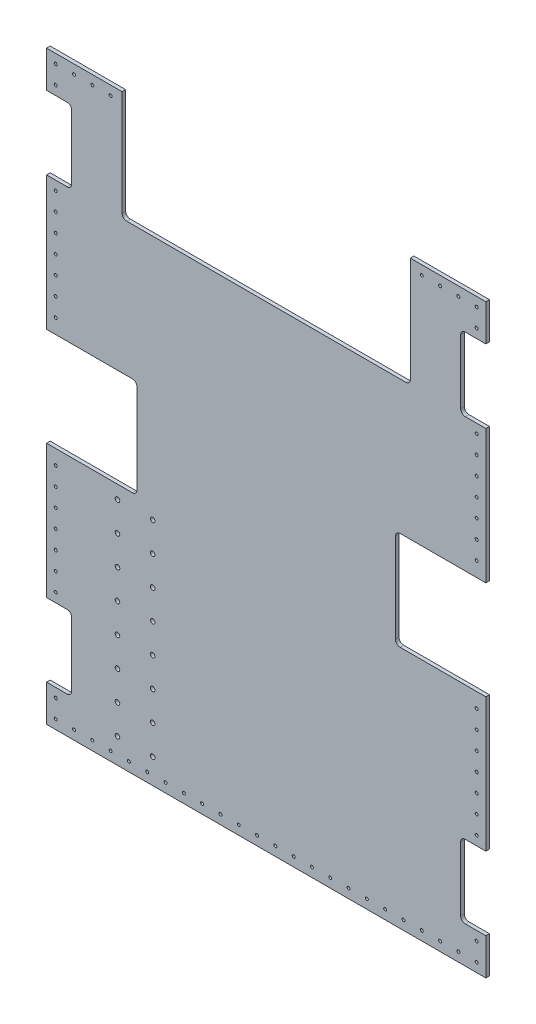
from build123d import *

# Parameters (mm, degrees)
BOSS_EXTRUDE1_DEPTH = 5
SKETCH4_R           = 2.0701
CUT_EXTRUDE1_DEPTH  = 712.6709914
LPATTERN2_COUNT     = 24
LPATTERN2_PITCH     = 25.4
LPATTERN3_COUNT     = 32
LPATTERN3_PITCH     = 25.4
LPATTERN4_OUTLINE_R = 2.0701
LPATTERN4_DEPTH     = 5
LPATTERN5_OUTLINE_R = 2.0701
LPATTERN5_DEPTH     = 5
FILLET1_R           = 6.35
SKETCH6_R           = 3.175
CUT_EXTRUDE2_DEPTH  = 712.6709914
LPATTERN6_COUNT     = 7
LPATTERN6_PITCH     = 40.64


# Read off the part's stored shape, not the designer's step: LPattern4, LPattern5
with BuildPart() as part:
    # Sketch1 → Boss-Extrude1 (new body)
    with BuildSketch(Plane.XY):
        Polygon((-549.275, -355.6), (-584.2, -355.6), (-584.2, -406.4), (25.4, -406.4), (25.4, -355.6), (-9.525, -355.6), (-9.525, -254), (25.4, -254), (25.4, -68.43150672), (-100.0125, -68.43150672), (-100.0125, 68.43150672), (25.4, 68.43150672), (25.4, 254), (-9.525, 254), (-9.525, 355.6), (25.4, 355.6), (25.4, 406.4), (-79.375, 406.4), (-79.375, 254), (-479.425, 254), (-479.425, 406.4), (-584.2, 406.4), (-584.2, 355.6), (-549.275, 355.6), (-549.275, 254), (-584.2, 254), (-584.2, 68.43150672), (-458.7875, 68.43150672), (-458.7875, -68.43150672), (-584.2, -68.43150672), (-584.2, -254), (-549.275, -254), align=None)
    extrude(amount=BOSS_EXTRUDE1_DEPTH)

    # Sketch4 → Cut-Extrude1 (cut, symmetric)
    with BuildSketch(Plane.XY.offset(5)):
        with Locations((-571.5, 393.7)):
            Circle(SKETCH4_R)
    cut_extrude1 = extrude(amount=CUT_EXTRUDE1_DEPTH, both=True, mode=Mode.SUBTRACT)

    # LPattern2: Cut-Extrude1 ×24, 16 skipped
    with Locations(*[(i * LPATTERN2_PITCH, 0, 0) for i in range(1, LPATTERN2_COUNT) if i not in (4, 5, 6, 7, 8, 9, 10, 11, 12, 13, 14, 15, 16, 17, 18, 19)]):
        add(cut_extrude1, mode=Mode.SUBTRACT)

    # LPattern3: Cut-Extrude1 ×32, 13 skipped
    with Locations(*[(0, -i * LPATTERN3_PITCH, 0) for i in range(1, LPATTERN3_COUNT) if i not in (2, 3, 4, 5, 14, 15, 16, 17, 18, 26, 27, 28, 29)]):
        add(cut_extrude1, mode=Mode.SUBTRACT)

    # LPattern4 outline → LPattern4 (cut)
    with BuildSketch(Plane.XY):
        with Locations((12.7, -393.7)):
            Circle(LPATTERN4_OUTLINE_R)
        with Locations((-12.7, -393.7)):
            Circle(LPATTERN4_OUTLINE_R)
        with Locations((-38.1, -393.7)):
            Circle(LPATTERN4_OUTLINE_R)
        with Locations((-63.5, -393.7)):
            Circle(LPATTERN4_OUTLINE_R)
        with Locations((-88.9, -393.7)):
            Circle(LPATTERN4_OUTLINE_R)
        with Locations((-114.3, -393.7)):
            Circle(LPATTERN4_OUTLINE_R)
        with Locations((-139.7, -393.7)):
            Circle(LPATTERN4_OUTLINE_R)
        with Locations((-165.1, -393.7)):
            Circle(LPATTERN4_OUTLINE_R)
        with Locations((-190.5, -393.7)):
            Circle(LPATTERN4_OUTLINE_R)
        with Locations((-215.9, -393.7)):
            Circle(LPATTERN4_OUTLINE_R)
        with Locations((-241.3, -393.7)):
            Circle(LPATTERN4_OUTLINE_R)
        with Locations((-266.7, -393.7)):
            Circle(LPATTERN4_OUTLINE_R)
        with Locations((-292.1, -393.7)):
            Circle(LPATTERN4_OUTLINE_R)
        with Locations((-317.5, -393.7)):
            Circle(LPATTERN4_OUTLINE_R)
        with Locations((-342.9, -393.7)):
            Circle(LPATTERN4_OUTLINE_R)
        with Locations((-368.3, -393.7)):
            Circle(LPATTERN4_OUTLINE_R)
        with Locations((-393.7, -393.7)):
            Circle(LPATTERN4_OUTLINE_R)
        with Locations((-419.1, -393.7)):
            Circle(LPATTERN4_OUTLINE_R)
        with Locations((-444.5, -393.7)):
            Circle(LPATTERN4_OUTLINE_R)
        with Locations((-469.9, -393.7)):
            Circle(LPATTERN4_OUTLINE_R)
        with Locations((-495.3, -393.7)):
            Circle(LPATTERN4_OUTLINE_R)
        with Locations((-520.7, -393.7)):
            Circle(LPATTERN4_OUTLINE_R)
        with Locations((-546.1, -393.7)):
            Circle(LPATTERN4_OUTLINE_R)
    extrude(amount=LPATTERN4_DEPTH, mode=Mode.SUBTRACT)

    # LPattern5 outline → LPattern5 (cut)
    with BuildSketch(Plane.XY):
        with Locations((12.7, -368.3)):
            Circle(LPATTERN5_OUTLINE_R)
        with Locations((12.7, -241.3)):
            Circle(LPATTERN5_OUTLINE_R)
        with Locations((12.7, -215.9)):
            Circle(LPATTERN5_OUTLINE_R)
        with Locations((12.7, -190.5)):
            Circle(LPATTERN5_OUTLINE_R)
        with Locations((12.7, -165.1)):
            Circle(LPATTERN5_OUTLINE_R)
        with Locations((12.7, -139.7)):
            Circle(LPATTERN5_OUTLINE_R)
        with Locations((12.7, -114.3)):
            Circle(LPATTERN5_OUTLINE_R)
        with Locations((12.7, -88.9)):
            Circle(LPATTERN5_OUTLINE_R)
        with Locations((12.7, 88.9)):
            Circle(LPATTERN5_OUTLINE_R)
        with Locations((12.7, 114.3)):
            Circle(LPATTERN5_OUTLINE_R)
        with Locations((12.7, 139.7)):
            Circle(LPATTERN5_OUTLINE_R)
        with Locations((12.7, 165.1)):
            Circle(LPATTERN5_OUTLINE_R)
        with Locations((12.7, 190.5)):
            Circle(LPATTERN5_OUTLINE_R)
        with Locations((12.7, 215.9)):
            Circle(LPATTERN5_OUTLINE_R)
        with Locations((12.7, 241.3)):
            Circle(LPATTERN5_OUTLINE_R)
        with Locations((12.7, 368.3)):
            Circle(LPATTERN5_OUTLINE_R)
    extrude(amount=LPATTERN5_DEPTH, mode=Mode.SUBTRACT)

    # Fillet1
    fillet1_edges = [part.edges().sort_by_distance(p)[0] for p in [
        (-549.275, -355.6, 2.5),
        (-549.275, -254, 2.5),
        (-458.7875, -68.43150672, 2.5),
        (-458.7875, 68.43150672, 2.5),
        (-549.275, 254, 2.5),
        (-549.275, 355.6, 2.5),
        (-479.425, 254, 2.5),
        (-79.375, 254, 2.5),
        (-9.525, 355.6, 2.5),
        (-9.525, 254, 2.5),
        (-100.0125, 68.43150672, 2.5),
        (-100.0125, -68.43150672, 2.5),
        (-9.525, -254, 2.5),
        (-9.525, -355.6, 2.5),
    ]]
    fillet(fillet1_edges, radius=FILLET1_R)

    # Sketch6 → Cut-Extrude2 (cut, through all)
    with BuildSketch(Plane(origin=(0, 0, 0), x_dir=(-1, 0, 0), z_dir=(0, 0, -1))):
        with Locations((436.9527202, -330.835)):
            Circle(SKETCH6_R)
        with Locations((436.9527202, -371.475)):
            Circle(SKETCH6_R)
        with Locations((485.7877, -371.475)):
            Circle(SKETCH6_R)
        with Locations((485.7877, -330.835)):
            Circle(SKETCH6_R)
        with BuildLine():
            ThreePointArc((436.9654202, -351.155), (436.961700456, -351.146019744), (436.9527202, -351.1423))
            Line((436.9527202, -351.1423), (436.9527202, -351.1677))
            ThreePointArc((436.9527202, -351.1677), (436.961700456, -351.163980256), (436.9654202, -351.155))
        make_face()
        with BuildLine():
            Line((436.9527202, -351.1677), (436.9527202, -351.1423))
            ThreePointArc((436.9527202, -351.1423), (436.9400202, -351.155), (436.9527202, -351.1677))
        make_face()
    cut_extrude2 = extrude(amount=-CUT_EXTRUDE2_DEPTH, mode=Mode.SUBTRACT)

    # LPattern6: Cut-Extrude2 ×7
    with Locations(*[(0, i * LPATTERN6_PITCH, 0) for i in range(1, LPATTERN6_COUNT)]):
        add(cut_extrude2, mode=Mode.SUBTRACT)


solid = part.part
